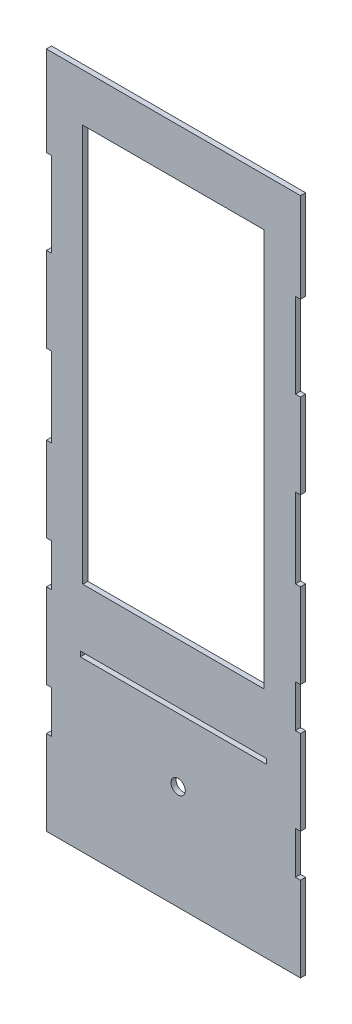
from build123d import *

# Parameters (mm, degrees)
SKETCH1_W             = 150
SKETCH1_H             = 400
BOSS_EXTRUDE1_DEPTH   = 3
SKETCH6_R             = 4.232555097
CUT_EXTRUDE5_DEPTH    = 3
CAVITY1_START         = -75
CAVITY1_OUTLINE_W     = 50
CAVITY1_OUTLINE_H     = 3
CAVITY1_OUTLINE_W_2   = 47
CAVITY1_OUTLINE_W_3   = 25
CAVITY1_DEPTH         = 3
CAVITY1_START_2       = 72
CAVITY1_2_OUTLINE_W   = 50
CAVITY1_2_OUTLINE_H   = 3
CAVITY1_2_OUTLINE_W_2 = 47
CAVITY1_2_OUTLINE_W_3 = 25
CAVITY1_2_DEPTH       = 3
CAVITY1_START_3       = -55
CAVITY1_3_OUTLINE_W   = 3
CAVITY1_3_OUTLINE_H   = 3
CAVITY1_3_DEPTH       = 110
SKETCH7_W             = 107.112189612
SKETCH7_H             = 234.735224044
CUT_EXTRUDE6_DEPTH    = 10


# Read off the part's stored shape, not the designer's step: Cavity1
with BuildPart() as part:
    # Sketch1 → Boss-Extrude1 (new body)
    with BuildSketch(Plane.XY):
        Rectangle(SKETCH1_W, SKETCH1_H)
    extrude(amount=BOSS_EXTRUDE1_DEPTH)

    # Sketch6 → Cut-Extrude5 (cut)
    with BuildSketch(Plane(origin=(0, 0, 0), x_dir=(-1, 0, 0), z_dir=(0, 0, -1))):
        with Locations((-2.75, -138.3)):
            Circle(SKETCH6_R)
    extrude(amount=-CUT_EXTRUDE5_DEPTH, mode=Mode.SUBTRACT)

    # Cavity1 outline → Cavity1 (cut)
    with BuildSketch(Plane.YZ.offset(CAVITY1_START)):
        with Locations((122, 1.5)):
            Rectangle(CAVITY1_OUTLINE_W, CAVITY1_OUTLINE_H)
        with Locations((23.5, 1.5)):
            Rectangle(CAVITY1_OUTLINE_W_2, CAVITY1_OUTLINE_H)
        with Locations((-62.5, 1.5)):
            Rectangle(CAVITY1_OUTLINE_W_3, CAVITY1_OUTLINE_H)
        with Locations((-137.5, 1.5)):
            Rectangle(CAVITY1_OUTLINE_W_3, CAVITY1_OUTLINE_H)
    extrude(amount=CAVITY1_DEPTH, mode=Mode.SUBTRACT)

    # Cavity1 2 outline → Cavity1 2 (cut)
    with BuildSketch(Plane.YZ.offset(CAVITY1_START_2)):
        with Locations((122, 1.5)):
            Rectangle(CAVITY1_2_OUTLINE_W, CAVITY1_2_OUTLINE_H)
        with Locations((23.5, 1.5)):
            Rectangle(CAVITY1_2_OUTLINE_W_2, CAVITY1_2_OUTLINE_H)
        with Locations((-62.5, 1.5)):
            Rectangle(CAVITY1_2_OUTLINE_W_3, CAVITY1_2_OUTLINE_H)
        with Locations((-137.5, 1.5)):
            Rectangle(CAVITY1_2_OUTLINE_W_3, CAVITY1_2_OUTLINE_H)
    extrude(amount=CAVITY1_2_DEPTH, mode=Mode.SUBTRACT)

    # Cavity1 3 outline → Cavity1 3 (cut)
    with BuildSketch(Plane.YZ.offset(CAVITY1_START_3)):
        with Locations((-99.307385879, 1.5)):
            Rectangle(CAVITY1_3_OUTLINE_W, CAVITY1_3_OUTLINE_H)
    extrude(amount=CAVITY1_3_DEPTH, mode=Mode.SUBTRACT)

    # Sketch7 → Cut-Extrude6 (cut)
    with BuildSketch(Plane.XY.offset(3)):
        with Locations((0, 54.41071334)):
            Rectangle(SKETCH7_W, SKETCH7_H)
    extrude(amount=-CUT_EXTRUDE6_DEPTH, mode=Mode.SUBTRACT)


solid = part.part
